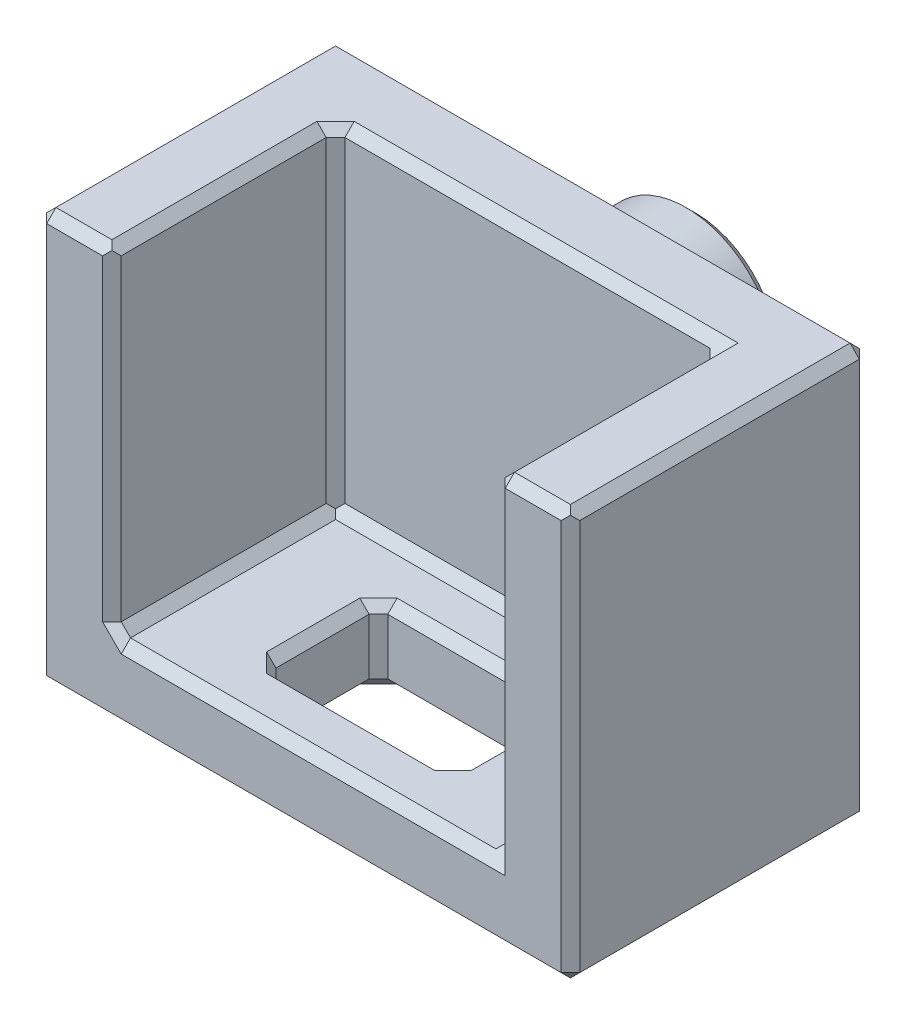
from build123d import *

# Parameters (mm, degrees)
SKETCH1_W           = 20.6
SKETCH1_H           = 4
BOSS_EXTRUDE1_DEPTH = 18
SKETCH2_W           = 16
SKETCH2_H           = 18
BOSS_EXTRUDE3_DEPTH = 4
SKETCH3_W           = 20.6
SKETCH3_H           = 4
BOSS_EXTRUDE4_DEPTH = 12
SKETCH4_R           = 4.9
BOSS_EXTRUDE5_DEPTH = 5
SKETCH5_W           = 10
SKETCH5_H           = 6
CUT_EXTRUDE1_DEPTH  = 10
BOSS_EXTRUDE6_DEPTH = 4
CHAMFER1_SIZE       = 0.5
CHAMFER2_SIZE       = 0.5


with BuildPart() as part:
    # Sketch1 → Boss-Extrude1 (new body)
    with BuildSketch(Plane(origin=(0, 0, 0), x_dir=(1, 0, 0), z_dir=(0, 1, 0))):
        Rectangle(SKETCH1_W, SKETCH1_H)
    extrude(amount=BOSS_EXTRUDE1_DEPTH)

    # Sketch2 → Boss-Extrude3 (add)
    with BuildSketch(Plane.ZY.offset(10.3)):
        with Locations((6, 9)):
            Rectangle(SKETCH2_W, SKETCH2_H)
    boss_extrude3 = extrude(amount=BOSS_EXTRUDE3_DEPTH)

    # Mirror1: Boss-Extrude3 across plane
    add(boss_extrude3.mirror(Plane.ZY))

    # Sketch3 → Boss-Extrude4 (add)
    with BuildSketch(Plane.XY.offset(2)):
        with Locations((0, 2)):
            Rectangle(SKETCH3_W, SKETCH3_H)
    extrude(amount=BOSS_EXTRUDE4_DEPTH)

    # Sketch4 → Boss-Extrude5 (add)
    with BuildSketch(Plane(origin=(0, 0, -2), x_dir=(-1, 0, 0), z_dir=(0, 0, -1))):
        with Locations(Location((0, 14, 0), (0, 0, 125.281261827))):
            Circle(SKETCH4_R)
    extrude(amount=BOSS_EXTRUDE5_DEPTH)

    # Sketch5 → Cut-Extrude1 (cut)
    with BuildSketch(Plane(origin=(0, 4, 0), x_dir=(1, 0, 0), z_dir=(0, 1, 0))):
        with Locations((0, -8)):
            Rectangle(SKETCH5_W, SKETCH5_H)
    extrude(amount=-CUT_EXTRUDE1_DEPTH, mode=Mode.SUBTRACT)

    # Sketch6 → Boss-Extrude6 (add)
    with BuildSketch(Plane(origin=(0, 18, 0), x_dir=(1, 0, 0), z_dir=(0, 1, 0))):
        Polygon((-10.3, -2), (10.3, -2), (10.3, -14), (14.3, -14), (14.3, 2), (2.83019434, 2), (-2.83019434, 2), (-14.3, 2), (-14.3, -14), (-10.3, -14), align=None)
    extrude(amount=BOSS_EXTRUDE6_DEPTH)

    # Chamfer1
    chamfer1_edges = [part.edges().sort_by_distance(p)[0] for p in [
        (0, 0, 14),
        (-14.3, 11, -2),
        (-14.3, 0, 6),
        (14.3, 11, -2),
        (14.3, 11, 14),
        (14.3, 0, 6),
        (-10.3, 13, 14),
        (0, 4, 14),
        (-10.3, 4, 8),
        (0, 0, -2),
        (-2.83019434, 10, -2),
        (-2.83019434, 10, -7),
        (5, 0, 8),
        (0, 0, 11),
        (5, 2, 11),
        (-5, 0, 8),
        (-5, 2, 11),
        (0, 0, 5),
        (-5, 2, 5),
        (5, 4, 8),
        (0, 4, 5),
        (-5, 4, 8),
        (0, 4, 11),
        (-10.3, 13, 2),
        (-10.3, 22, 8),
        (0, 22, 2),
        (14.3, 22, 6),
        (0, 22, -2),
    ]]
    chamfer(chamfer1_edges, length=CHAMFER1_SIZE)

    # Chamfer2
    chamfer2_edges = [part.edges().sort_by_distance(p)[0] for p in [
        (5, 2, 5),
        (10.3, 4, 7.75),
        (-14.3, 22, 6.25),
        (-14.3, 11.25, 14),
        (10.3, 12.75, 2),
        (10.3, 12.75, 14),
        (0.25, 4, 2),
        (10.3, 22, 7.75),
        (12.05, 22, 14),
        (-12.55, 22, 14),
    ]]
    chamfer(chamfer2_edges, length=CHAMFER2_SIZE - 0.0001)  # a hair under: the kernel refuses the full size


solid = part.part
